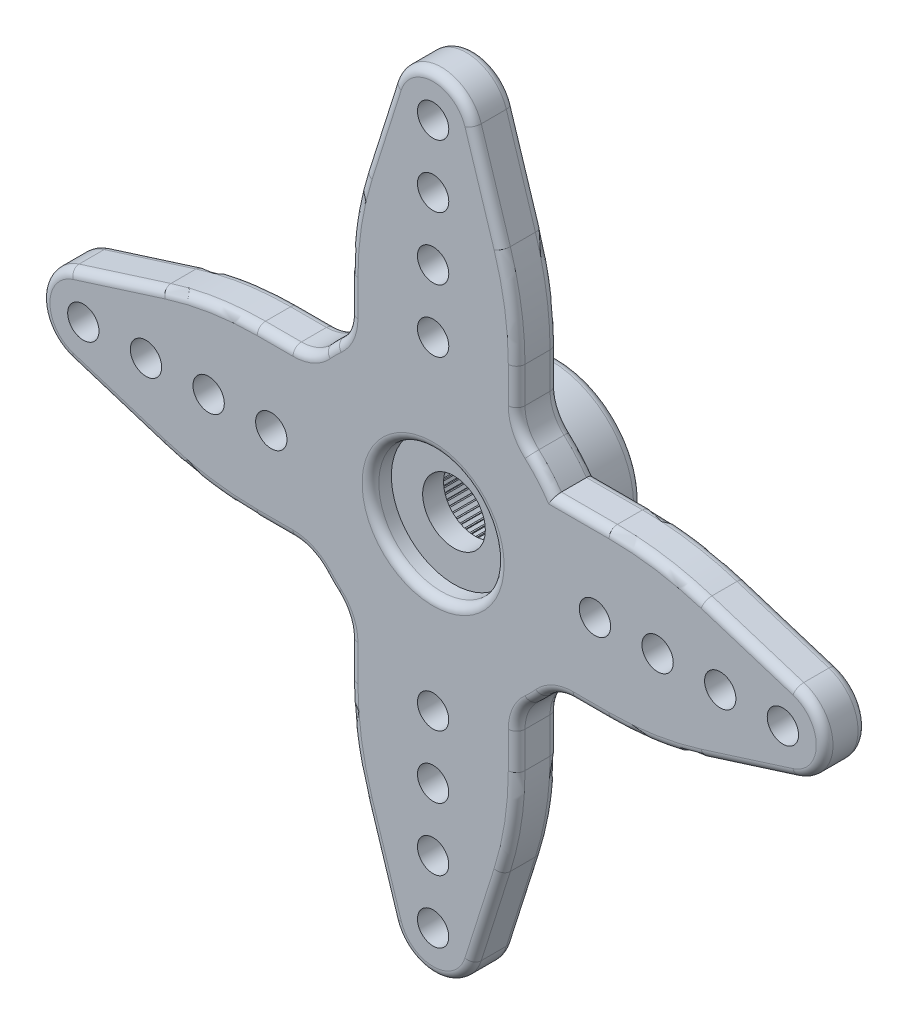
from build123d import *

# Parameters (mm, degrees)
SKETCH1_R                = 7
SKETCH1_R_2              = 1.5
SKETCH1_R_3              = 2
BOSS_EXTRUDE1_DEPTH      = 2
FILLET1_R                = 15
SKETCH2_R                = 0.75
CUT_EXTRUDE1_DEPTH       = 21.113739086
CIRPATTERN2_COUNT        = 4
FILLET1_OF_CIRPATTERN2_R = 15
FILLET2_R                = 2
SKETCH3_R                = 3
CUT_EXTRUDE2_DEPTH       = 1
SKETCH4_R                = 4
SKETCH4_R_2              = 3
BOSS_EXTRUDE2_DEPTH      = 4
SKETCH5_W                = 0.05
SKETCH5_H                = 0.5
BOSS_EXTRUDE3_DEPTH      = 4
CIRPATTERN3_COUNT        = 80
FILLET3_R                = 0.4


with BuildPart() as part:
    # Sketch1 → Boss-Extrude1 (new body)
    # profile 1 of 3: a face of its own
    with BuildSketch(Plane.XY):
        Circle(SKETCH1_R)
        Circle(SKETCH1_R_2, mode=Mode.SUBTRACT)
    # profile 2 of 3: a face of its own
    with BuildSketch(Plane.XY):
        with BuildLine():
            Line((-1.906651599, 17.353887141), (-4, 10.744562647))
            Line((-4, 10.744562647), (-4, 5.744562647))
            ThreePointArc((-4, 5.744562647), (0, 7), (4, 5.744562647))
            Line((4, 5.744562647), (4, 10.744562647))
            Line((4, 10.744562647), (1.906651599, 17.353887141))
            ThreePointArc((1.906651599, 17.353887141), (1.976525132, 17.055529705), (2, 16.75))
            ThreePointArc((2, 16.75), (-0.305529705, 14.773474868), (-1.906651599, 17.353887141))
        make_face()
    # profile 3 of 3: a face of its own
    with BuildSketch(Plane.XY):
        with Locations((0, 16.75)):
            Circle(SKETCH1_R_3)
    boss_extrude1 = extrude(amount=BOSS_EXTRUDE1_DEPTH)

    # Fillet1
    fillet1_edges = [part.edges().sort_by_distance(p)[0] for p in [
        (-4, 10.744562647, 1),
        (4, 10.744562647, 1),
    ]]
    fillet(fillet1_edges, radius=FILLET1_R)

    # Sketch2 → Cut-Extrude1 (cut, through all)
    with BuildSketch(Plane.XY.offset(2)):
        with Locations((0, 16.75)):
            Circle(SKETCH2_R)
        with Locations((0, 13.75)):
            Circle(SKETCH2_R)
        with Locations((0, 10.75)):
            Circle(SKETCH2_R)
        with Locations((0, 7.75)):
            Circle(SKETCH2_R)
    cut_extrude1 = extrude(amount=-CUT_EXTRUDE1_DEPTH, mode=Mode.SUBTRACT)

    # CirPattern2: Boss-Extrude1, Cut-Extrude1 ×4 about axis
    cirpattern2_axis = Axis((0, 0, 0), (0, 0, 1))
    add([boss_extrude1.rotate(cirpattern2_axis, i * 360 / CIRPATTERN2_COUNT) for i in range(1, CIRPATTERN2_COUNT)])
    add([cut_extrude1.rotate(cirpattern2_axis, i * 360 / CIRPATTERN2_COUNT) for i in range(1, CIRPATTERN2_COUNT)], mode=Mode.SUBTRACT)

    # Fillet1 of CirPattern2
    fillet1_of_cirpattern2_edges = [part.edges().sort_by_distance(p)[0] for p in [
        (-10.744562647, -4, 1),
        (-10.744562647, 4, 1),
        (4, -10.744562647, 1),
        (-4, -10.744562647, 1),
        (10.744562647, 4, 1),
        (10.744562647, -4, 1),
    ]]
    fillet(fillet1_of_cirpattern2_edges, radius=FILLET1_OF_CIRPATTERN2_R)

    # Fillet2
    fillet2_edges = [part.edges().sort_by_distance(p)[0] for p in [
        (-4, 5.744562647, 1),
        (4, 5.744562647, 1),
        (4, -5.744562647, 1),
        (-5.744562647, -4, 1),
        (-5.744562647, 4, 1),
        (5.744562647, -4, 1),
        (-4, -5.744562647, 1),
    ]]
    fillet(fillet2_edges, radius=FILLET2_R)

    # Sketch3 → Cut-Extrude2 (cut)
    with BuildSketch(Plane.XY.offset(2)):
        Circle(SKETCH3_R)
    extrude(amount=-CUT_EXTRUDE2_DEPTH, mode=Mode.SUBTRACT)

    # Sketch4 → Boss-Extrude2 (add)
    with BuildSketch(Plane(origin=(0, 0, 0), x_dir=(-1, 0, 0), z_dir=(0, 0, -1))):
        with Locations(Location((0, 0, 0), (0, 0, 180))):
            Circle(SKETCH4_R)
        with Locations(Location((0, 0, 0), (0, 0, 180))):
            Circle(SKETCH4_R_2, mode=Mode.SUBTRACT)
    extrude(amount=BOSS_EXTRUDE2_DEPTH)

    # Sketch5 → Boss-Extrude3 (add)
    with BuildSketch(Plane(origin=(0, 0, -4), x_dir=(-1, 0, 0), z_dir=(0, 0, -1))):
        with Locations((0, -3.144105088)):
            Rectangle(SKETCH5_W, SKETCH5_H)
    boss_extrude3 = extrude(amount=-BOSS_EXTRUDE3_DEPTH)

    # CirPattern3: Boss-Extrude3 ×80 about axis
    cirpattern3_axis = Axis((0, 0, 0), (0, 0, 1))
    for i in range(1, CIRPATTERN3_COUNT):
        add(boss_extrude3.rotate(cirpattern3_axis, i * 360 / CIRPATTERN3_COUNT))

    # Fillet3
    fillet3_edges = [part.edges().sort_by_distance(p)[0] for p in [
        (-7.567039169, -4, 0),
        (-7.567039169, -4, 2),
        (-7.567039169, 4, 0),
        (-10.717347197, 3.823938493, 0),
        (-10.717347197, -3.823938493, 0),
        (-7.567039169, 4, 2),
        (-10.717347197, 3.823938493, 2),
        (-10.717347197, -3.823938493, 2),
        (4, -7.567039169, 0),
        (4, -7.567039169, 2),
        (-4, -7.567039169, 0),
        (-3.823938493, -10.717347197, 0),
        (3.823938493, -10.717347197, 0),
        (-4, -7.567039169, 2),
        (-3.823938493, -10.717347197, 2),
        (3.823938493, -10.717347197, 2),
        (7.085218526, 4, 0),
        (7.085218526, 4, 2),
        (7.567039169, -4, 0),
        (10.717347197, -3.823938493, 0),
        (10.717347197, 3.823938493, 0),
        (7.567039169, -4, 2),
        (10.717347197, -3.823938493, 2),
        (10.717347197, 3.823938493, 2),
        (2.603269296, 15.154457554, 2),
        (0, 18.75, 2),
        (4.949747468, -4.949747468, 0),
        (4.949747468, -4.949747468, 2),
        (-4.949747468, 4.949747468, 0),
        (-4.949747468, 4.949747468, 2),
        (-4.949747468, -4.949747468, 0),
        (-4.949747468, -4.949747468, 2),
        (-4, 7.567039169, 0),
        (-4, 7.567039169, 2),
        (5.891707352, -4.174258142, 0),
        (5.891707352, -4.174258142, 2),
        (4.174258142, -5.891707352, 0),
        (4.174258142, -5.891707352, 2),
        (-5.891707352, 4.174258142, 0),
        (-5.891707352, 4.174258142, 2),
        (-4.174258142, -5.891707352, 0),
        (-4.174258142, -5.891707352, 2),
        (-5.891707352, -4.174258142, 0),
        (-5.891707352, -4.174258142, 2),
        (4.174258142, 5.891707352, 0),
        (4.174258142, 5.891707352, 2),
        (-4.174258142, 5.891707352, 0),
        (-4.174258142, 5.891707352, 2),
        (-2.603269296, 15.154457554, 2),
        (4, 7.567039169, 0),
        (3.823938493, 10.717347197, 0),
        (-3.823938493, 10.717347197, 0),
        (-3, 0, 2),
        (4, 7.567039169, 2),
        (-4, 0, 0),
        (3.823938493, 10.717347197, 2),
        (-4, 0, -4),
        (-3.823938493, 10.717347197, 2),
        (5.241087255, 4.640151332, 0),
        (5.241087255, 4.640151332, 2),
        (-18.75, 0, 2),
        (-15.154457554, -2.603269296, 2),
        (0, -18.75, 2),
        (2.603269296, -15.154457554, 2),
        (18.75, 0, 2),
        (15.154457554, 2.603269296, 2),
        (-15.154457554, 2.603269296, 0),
        (-2.603269296, -15.154457554, 0),
        (15.154457554, -2.603269296, 0),
        (-15.154457554, 2.603269296, 2),
        (-18.75, 0, 0),
        (-15.154457554, -2.603269296, 0),
        (18.75, 0, 0),
        (15.154457554, -2.603269296, 2),
        (15.154457554, 2.603269296, 0),
        (-2.603269296, -15.154457554, 2),
        (0, -18.75, 0),
        (2.603269296, -15.154457554, 0),
        (-2.603269296, 15.154457554, 0),
        (0, 18.75, 0),
        (2.603269296, 15.154457554, 0),
    ]]
    fillet(fillet3_edges, radius=FILLET3_R)


solid = part.part
